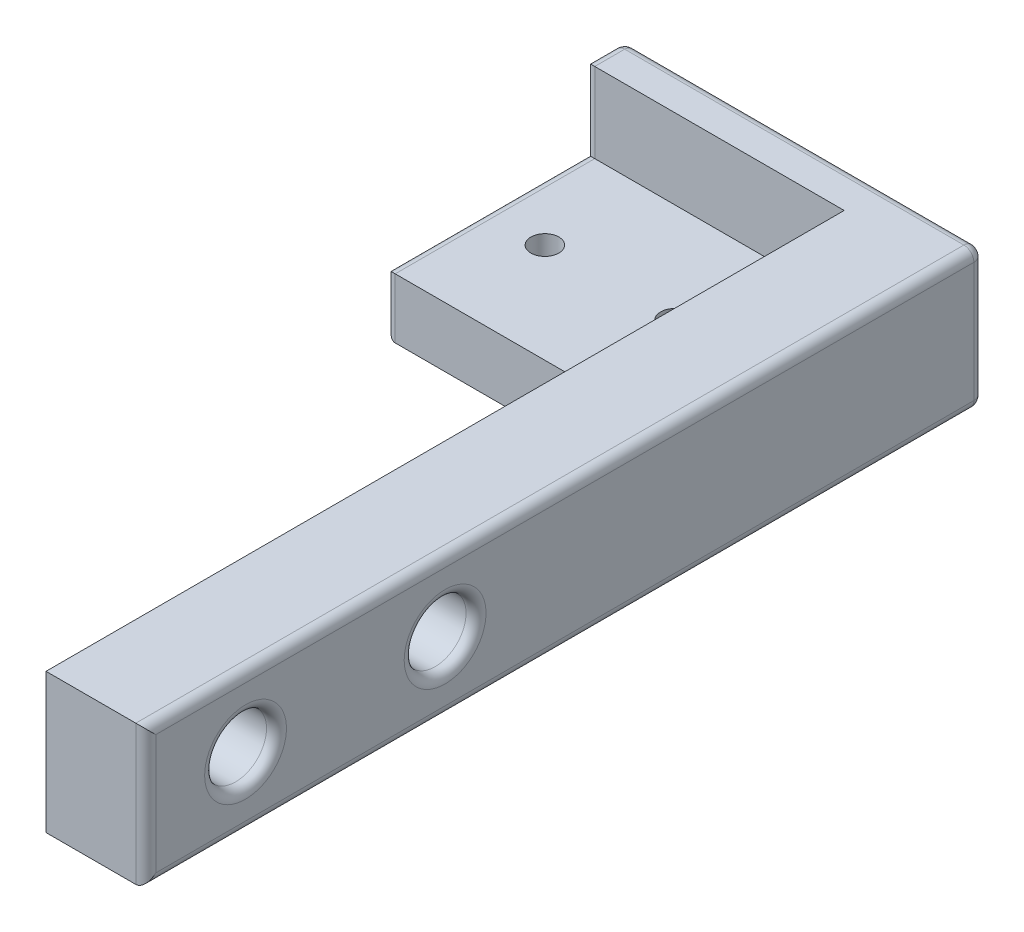
from build123d import *

# Parameters (mm, degrees)
SKETCH_1_R          = 0.7
EXTRUDE_1_DEPTH     = 7
SKETCH_2_R          = 1.55
CUT_EXTRUDE_1_DEPTH = 32.591137998
SKETCH_3_W          = 13
SKETCH_3_H          = 10
CUT_EXTRUDE_2_DEPTH = 4
SKETCH_4_W          = 18
SKETCH_4_H          = 2
EXTRUDE_2_DEPTH     = 7
FILLET_1_R          = 0.5
FILLET_2_R          = 0.5


with BuildPart() as part:
    # 草图1 → 凸台-拉伸1 (new body)
    with BuildSketch(Plane(origin=(0, 0, 0), x_dir=(1, 0, 0), z_dir=(0, 1, 0))):
        Polygon((-2.5, 15), (-2.5, -15), (2.5, -15), (2.5, 15), (2.5, 25), (-15.5, 25), (-15.5, 15), align=None)
        with Locations(Location((-12.5, 20, 0), (0, 0, 270))):
            Circle(SKETCH_1_R, mode=Mode.SUBTRACT)
        with Locations(Location((-6, 20, 0), (0, 0, 270))):
            Circle(SKETCH_1_R, mode=Mode.SUBTRACT)
    extrude(amount=EXTRUDE_1_DEPTH)

    # 草图2 → 切除-拉伸1 (cut, through all)
    with BuildSketch(Plane(origin=(2.5, 0, 0), x_dir=(0, 0, -1), z_dir=(1, 0, 0))):
        with Locations((-10, 3.5)):
            Circle(SKETCH_2_R)
        with Locations((0, 3.5)):
            Circle(SKETCH_2_R)
    extrude(amount=-CUT_EXTRUDE_1_DEPTH, mode=Mode.SUBTRACT)

    # 草图3 → 切除-拉伸2 (cut)
    with BuildSketch(Plane(origin=(0, 7, 0), x_dir=(1, 0, 0), z_dir=(0, 1, 0))):
        with Locations((-9, 20)):
            Rectangle(SKETCH_3_W, SKETCH_3_H)
    extrude(amount=-CUT_EXTRUDE_2_DEPTH, mode=Mode.SUBTRACT)

    # 草图4 → 凸台-拉伸2 (add)
    with BuildSketch(Plane.XZ):
        with Locations((-6.5, -26)):
            Rectangle(SKETCH_4_W, SKETCH_4_H)
    extrude(amount=-EXTRUDE_2_DEPTH)

    # 圆角1
    fillet_1_edges = [part.edges().sort_by_distance(p)[0] for p in [
        (2.5, 3.5, 15),
        (2.5, 3.5, 11.55),
        (2.5, 3.5, 1.55),
        (2.5, 7, -6),
        (-15.5, 3.5, -27),
        (-6.5, 7, -27),
        (2.5, 3.5, -27),
        (-6.5, 0, -27),
        (2.5, 0, -6),
    ]]
    fillet(fillet_1_edges, radius=FILLET_1_R)

    # 圆角2
    # the kernel refuses this fillet: 0.5 mm, written as the material it takes off along each edge
    with BuildSketch(Plane(origin=(-15, 6.5, -26.5), x_dir=(-1, 0, 0), z_dir=(0, 1, 0))) as fillet_2_piece_1_section:
        Polygon((0, 0), (FILLET_2_R, 0), (FILLET_2_R, -FILLET_2_R), (0, -FILLET_2_R), align=None)
    fillet_2_piece_1 = extrude(amount=FILLET_2_R, mode=Mode.PRIVATE)
    fillet_2_piece_1 = fillet_2_piece_1 - Plane(origin=(-15, 6.5, -26.5), x_dir=(0.7071067811865475, 0, 0.7071067811865475), z_dir=(0, 1, 0)) * Sphere(FILLET_2_R, mode=Mode.PRIVATE)
    add(fillet_2_piece_1, mode=Mode.SUBTRACT)
    with BuildSketch(Plane(origin=(-15, 0.5, -26.5), x_dir=(-1, 0, 0), z_dir=(0, -1, 0))) as fillet_2_piece_2_section:
        Polygon((0, 0), (FILLET_2_R, 0), (FILLET_2_R, FILLET_2_R), (0, FILLET_2_R), align=None)
    fillet_2_piece_2 = extrude(amount=FILLET_2_R, mode=Mode.PRIVATE)
    fillet_2_piece_2 = fillet_2_piece_2 - Plane(origin=(-15, 0.5, -26.5), x_dir=(0.7071067811865475, 0, 0.7071067811865475), z_dir=(0, -1, 0)) * Sphere(FILLET_2_R, mode=Mode.PRIVATE)
    add(fillet_2_piece_2, mode=Mode.SUBTRACT)
    with BuildSketch(Plane(origin=(-15.5, -1.25, -15), x_dir=(1, 0, 0), z_dir=(0, 1, 0))) as fillet_2_piece_3:
        with BuildLine():
            CenterArc((FILLET_2_R, FILLET_2_R), FILLET_2_R, 180, 90)
            Line((0, FILLET_2_R), (0, 0))
            Line((0, 0), (FILLET_2_R, 0))
        make_face()
    extrude(amount=5.5, mode=Mode.SUBTRACT)
    with BuildSketch(Plane(origin=(-15.5, 3, -25), x_dir=(1, 0, 0), z_dir=(0, 0, 1))) as fillet_2_piece_4:
        with BuildLine():
            CenterArc((FILLET_2_R, -FILLET_2_R), FILLET_2_R, 90, 90)
            Line((0, -FILLET_2_R), (0, 0))
            Line((0, 0), (FILLET_2_R, 0))
        make_face()
    extrude(amount=11.25, mode=Mode.SUBTRACT)
    with BuildSketch(Plane(origin=(-15.5, 3, -25), x_dir=(1, 0, 0), z_dir=(0, 1, 0))) as fillet_2_piece_5:
        with BuildLine():
            CenterArc((FILLET_2_R, FILLET_2_R), FILLET_2_R, 180, 90)
            Line((0, FILLET_2_R), (0, 0))
            Line((0, 0), (FILLET_2_R, 0))
        make_face()
    extrude(amount=5.25, mode=Mode.SUBTRACT)
    with BuildSketch(Plane(origin=(-15.5, 7, -26.5), x_dir=(1, 0, 0), z_dir=(0, 0, 1))) as fillet_2_piece_6:
        with BuildLine():
            CenterArc((FILLET_2_R, -FILLET_2_R), FILLET_2_R, 90, 90)
            Line((0, -FILLET_2_R), (0, 0))
            Line((0, 0), (FILLET_2_R, 0))
        make_face()
    extrude(amount=2.75, mode=Mode.SUBTRACT)
    with BuildSketch(Plane(origin=(-15.5, 0, -13.75), x_dir=(1, 0, 0), z_dir=(0, 0, -1))) as fillet_2_piece_7:
        with BuildLine():
            CenterArc((FILLET_2_R, -FILLET_2_R), FILLET_2_R, 90, 90)
            Line((0, -FILLET_2_R), (0, 0))
            Line((0, 0), (FILLET_2_R, 0))
        make_face()
    extrude(amount=12.75, mode=Mode.SUBTRACT)
    with BuildSketch(Plane(origin=(-15.5, 3, -26.25), x_dir=(1, 0, 0), z_dir=(0, 0, 1))) as fillet_2_piece_8a_section:
        with BuildLine():
            CenterArc((FILLET_2_R, -FILLET_2_R), FILLET_2_R, 90, 90)
            Line((0, -FILLET_2_R), (0, 0))
            Line((0, 0), (FILLET_2_R, 0))
        make_face()
    fillet_2_piece_8a = extrude(amount=12.5, mode=Mode.PRIVATE)
    fillet_2_piece_8a = split(fillet_2_piece_8a, bisect_by=Plane(origin=(-15.386802443, 2.886802443, -25), z_dir=(0, 0, -1)), keep=Keep.TOP, mode=Mode.PRIVATE)
    with BuildSketch(Plane(origin=(-15.5, 1.75, -25), x_dir=(1, 0, 0), z_dir=(0, 1, 0))) as fillet_2_piece_8b_section:
        with BuildLine():
            CenterArc((FILLET_2_R, FILLET_2_R), FILLET_2_R, 180, 90)
            Line((0, FILLET_2_R), (0, 0))
            Line((0, 0), (FILLET_2_R, 0))
        make_face()
    fillet_2_piece_8b = extrude(amount=6.5, mode=Mode.PRIVATE)
    fillet_2_piece_8b = split(fillet_2_piece_8b, bisect_by=Plane(origin=(-15.386802443, 3, -25.113197557), z_dir=(0, -1, 0)), keep=Keep.TOP, mode=Mode.PRIVATE)
    fillet_2_piece_8 = fillet_2_piece_8a & fillet_2_piece_8b
    add(fillet_2_piece_8, mode=Mode.SUBTRACT)


solid = part.part
